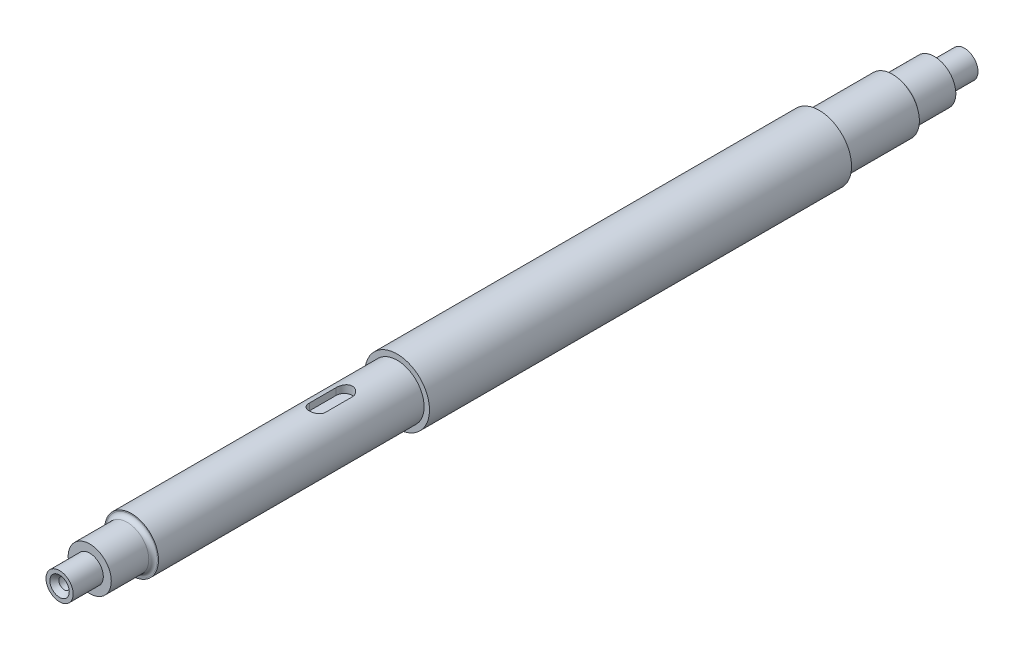
from build123d import *

# Parameters (mm, degrees)
SKETCH1_R            = 9.525
BOSS_EXTRUDE1_DEPTH  = 139.7
CUT_EXTRUDE1_REACH   = 232.645
SKETCH3_R            = 9.525
SKETCH3_R_2          = 7.9375
CUT_EXTRUDE2_REACH   = 266.503
SKETCH4_R            = 7.9375
SKETCH4_R_2          = 4
SKETCH5_R            = 9.525
SKETCH5_R_2          = 7.9375
CUT_EXTRUDE3_DEPTH   = 58.6105
CUT_EXTRUDE4_DEPTH   = 2.38125
SKETCH7_R            = 7.9375
SKETCH7_R_2          = 6.35
CUT_EXTRUDE5_DEPTH   = 12.319
FILLET1_R            = 1.27
SKETCH8_R            = 4
CUT_EXTRUDE6_DEPTH   = 6.35
FILLET1_OF_MIRROR3_R = 1.27
BOSS_EXTRUDE2_START  = 1.905
SKETCH11_R           = 9.525
SKETCH11_R_2         = 7.9375
BOSS_EXTRUDE2_DEPTH  = 1.905


with BuildPart() as part:
    # Sketch1 → Boss-Extrude1 (new, symmetric)
    with BuildSketch(Plane.XY):
        Circle(SKETCH1_R)
    extrude(amount=BOSS_EXTRUDE1_DEPTH, both=True)

    # Sketch3 → Cut-Extrude1 (cut, up to next)
    with BuildSketch(Plane.XY.offset(90.551), mode=Mode.PRIVATE) as cut_extrude1_sk1:
        Circle(SKETCH3_R)
        Circle(SKETCH3_R_2, mode=Mode.SUBTRACT)
    cut_extrude1_tool1 = extrude(cut_extrude1_sk1.sketch, amount=CUT_EXTRUDE1_REACH, mode=Mode.PRIVATE) & part.part
    cut_extrude1 = cut_extrude1_tool1.solids().sort_by_distance((-9.255592, 0, 90.551))[0]
    add(cut_extrude1, mode=Mode.SUBTRACT)

    # Mirror1: Cut-Extrude1 across plane
    add(cut_extrude1.mirror(Plane.XY), mode=Mode.SUBTRACT)

    # Sketch4 → Cut-Extrude2 (cut, up to next)
    with BuildSketch(Plane.XY.offset(124.46), mode=Mode.PRIVATE) as cut_extrude2_sk1:
        Circle(SKETCH4_R)
        Circle(SKETCH4_R_2, mode=Mode.SUBTRACT)
    cut_extrude2_tool1 = extrude(cut_extrude2_sk1.sketch, amount=CUT_EXTRUDE2_REACH, mode=Mode.PRIVATE) & part.part
    cut_extrude2 = cut_extrude2_tool1.solids().sort_by_distance((-7.712994, 0, 124.46))[0]
    add(cut_extrude2, mode=Mode.SUBTRACT)

    # Mirror2: Cut-Extrude2 across plane
    add(cut_extrude2.mirror(Plane.XY), mode=Mode.SUBTRACT)

    # Sketch5 → Cut-Extrude3 (cut)
    with BuildSketch(Plane.XY.offset(90.551)):
        Circle(SKETCH5_R)
        Circle(SKETCH5_R_2, mode=Mode.SUBTRACT)
    extrude(amount=-CUT_EXTRUDE3_DEPTH, mode=Mode.SUBTRACT)

    # Sketch6 → Cut-Extrude4 (cut)
    with BuildSketch(Plane(origin=(0, 7.9375, 0), x_dir=(1, 0, 0), z_dir=(0, 1, 0))):
        with BuildLine():
            Line((-2.38125, -49.43475), (-2.38125, -57.37225))
            ThreePointArc((-2.38125, -57.37225), (0, -59.7535), (2.38125, -57.37225))
            Line((2.38125, -57.37225), (2.38125, -49.43475))
            ThreePointArc((2.38125, -49.43475), (0, -47.0535), (-2.38125, -49.43475))
        make_face()
    extrude(amount=-CUT_EXTRUDE4_DEPTH, mode=Mode.SUBTRACT)

    # Sketch7 → Cut-Extrude5 (cut)
    with BuildSketch(Plane.XY.offset(124.46)):
        Circle(SKETCH7_R)
        Circle(SKETCH7_R_2, mode=Mode.SUBTRACT)
    cut_extrude5 = extrude(amount=-CUT_EXTRUDE5_DEPTH, mode=Mode.SUBTRACT)

    # Fillet1
    fillet1_edges = [part.edges().sort_by_distance(p)[0] for p in [
        (-6.35, 0, 112.141),
    ]]
    fillet(fillet1_edges, radius=FILLET1_R)

    # Sketch8 → Cut-Extrude6 (cut)
    with BuildSketch(Plane.XY.offset(139.7)):
        Circle(SKETCH8_R)
    cut_extrude6 = extrude(amount=-CUT_EXTRUDE6_DEPTH, mode=Mode.SUBTRACT)

    # Sketch10 → CSK for #4 Flat Head Machine Screw1 (revolve, cut)
    with BuildSketch(Plane(origin=(0, 0, 133.35), x_dir=(0, -1, 0), z_dir=(1, 0, 0))):
        Polygon((0, 0), (0, 7.330574487), (1.63195, 6.35), (1.63195, 1.409834001), (2.8575, 0), align=None)
    csk_for_4_flat_head_machine_screw1 = revolve(axis=Axis((0, 0, 139.7), (0, 0, -1)), mode=Mode.SUBTRACT)

    # Mirror3: Cut-Extrude5, Cut-Extrude6, CSK for #4 Flat Head Machine Screw1 across plane
    add(cut_extrude5.mirror(Plane.XY), mode=Mode.SUBTRACT)
    add(cut_extrude6.mirror(Plane.XY), mode=Mode.SUBTRACT)
    add(csk_for_4_flat_head_machine_screw1.mirror(Plane.XY), mode=Mode.SUBTRACT)

    # Fillet1 of Mirror3
    fillet1_of_mirror3_edges = [part.edges().sort_by_distance(p)[0] for p in [
        (-6.35, 0, -112.141),
    ]]
    fillet(fillet1_of_mirror3_edges, radius=FILLET1_OF_MIRROR3_R)

    # Sketch11 → Boss-Extrude2 (add)
    with BuildSketch(Plane.XY.offset(31.9405).offset(BOSS_EXTRUDE2_START)):
        Circle(SKETCH11_R)
        Circle(SKETCH11_R_2, mode=Mode.SUBTRACT)
    extrude(amount=-BOSS_EXTRUDE2_DEPTH)


solid = part.part
